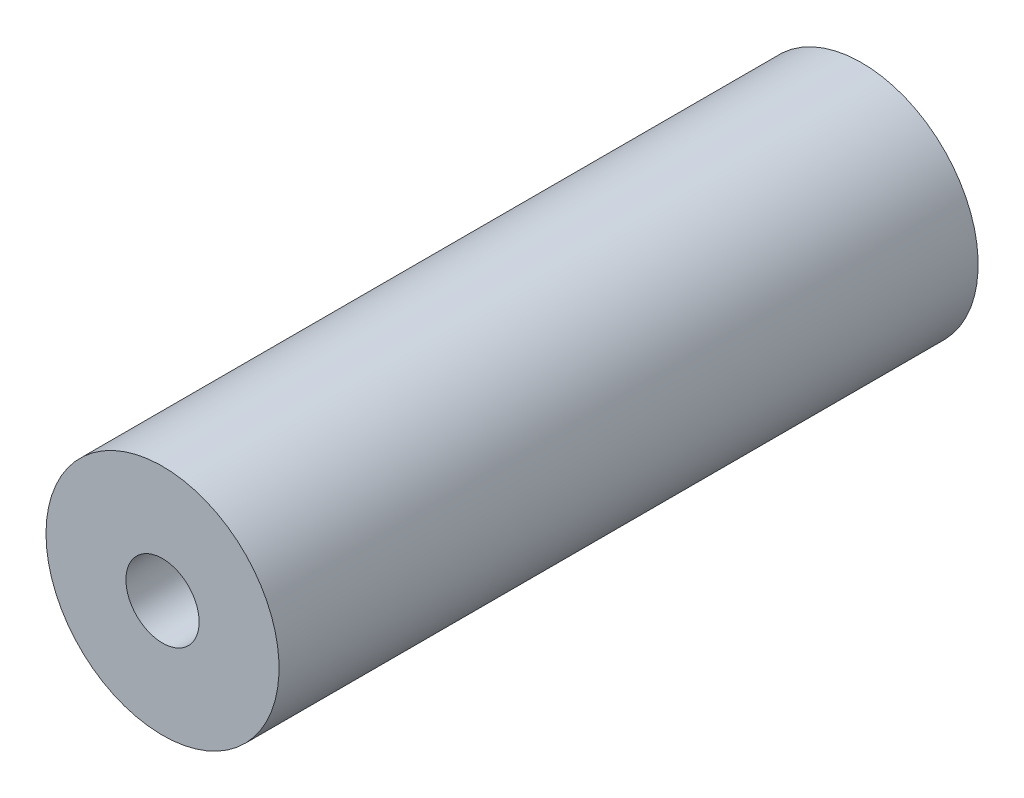
from build123d import *

# Parameters (mm, degrees)
SKETCH2_R           = 3.5
BOSS_EXTRUDE1_DEPTH = 21
SKETCH7_R           = 1.1
CUT_EXTRUDE2_DEPTH  = 6
SKETCH4_W           = 4.65
SKETCH4_H           = 4.65
CUT_EXTRUDE5_DEPTH  = 10.2


with BuildPart() as part:
    # Sketch2 → Boss-Extrude1 (new body)
    with BuildSketch(Plane.XY):
        Circle(SKETCH2_R)
    extrude(amount=BOSS_EXTRUDE1_DEPTH)

    # Sketch7 → Cut-Extrude2 (cut)
    with BuildSketch(Plane.XY.offset(21)):
        Circle(SKETCH7_R)
    extrude(amount=-CUT_EXTRUDE2_DEPTH, mode=Mode.SUBTRACT)

    # Sketch4 → Cut-Extrude5 (cut)
    with BuildSketch(Plane(origin=(0, 0, 0), x_dir=(-1, 0, 0), z_dir=(0, 0, -1))):
        Rectangle(SKETCH4_W, SKETCH4_H)
    extrude(amount=-CUT_EXTRUDE5_DEPTH, mode=Mode.SUBTRACT)


solid = part.part
